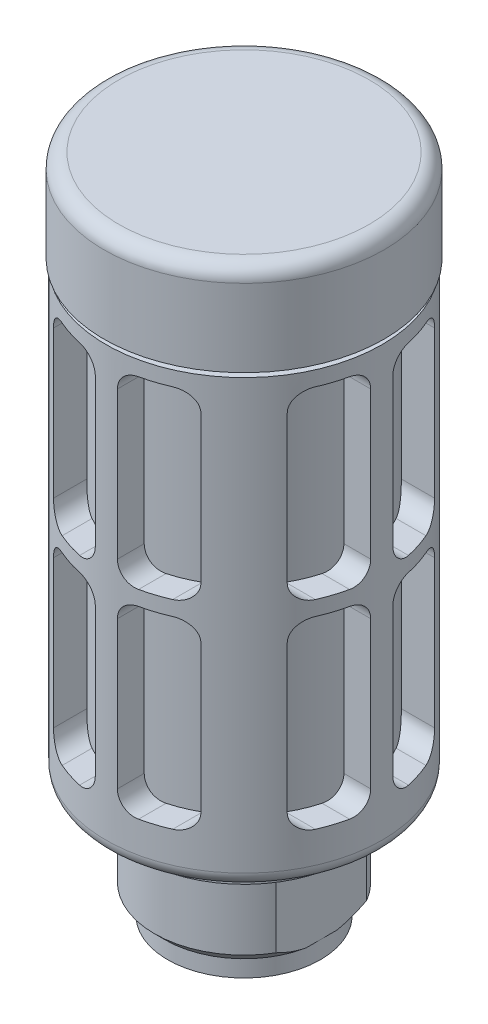
from build123d import *

# Parameters (mm, degrees)
SCHNITT_LINEAR_AUSTRAGEN1_DEPTH      = 20
SCHNITT_LINEAR_AUSTRAGEN1_DEPTH_BACK = 20
SCHNITT_LINEAR_AUSTRAGEN2_DEPTH      = 20
SCHNITT_LINEAR_AUSTRAGEN2_DEPTH_BACK = 20
SCHNITT_LINEAR_AUSTRAGEN3_DEPTH      = 20
SCHNITT_LINEAR_AUSTRAGEN3_DEPTH_BACK = 20
SCHNITT_LINEAR_AUSTRAGEN4_DEPTH      = 20
SCHNITT_LINEAR_AUSTRAGEN4_DEPTH_BACK = 20
SCHNITT_LINEAR_AUSTRAGEN5_DEPTH      = 20
SCHNITT_LINEAR_AUSTRAGEN5_DEPTH_BACK = 20
SCHNITT_LINEAR_AUSTRAGEN6_DEPTH      = 20
SCHNITT_LINEAR_AUSTRAGEN6_DEPTH_BACK = 20
SCHNITT_LINEAR_AUSTRAGEN7_DEPTH      = 20
SCHNITT_LINEAR_AUSTRAGEN7_DEPTH_BACK = 20
SCHNITT_LINEAR_AUSTRAGEN8_DEPTH      = 20
SCHNITT_LINEAR_AUSTRAGEN8_DEPTH_BACK = 20
SCHNITT_LINEAR_AUSTRAGEN9_DEPTH      = 15
SCHNITT_LINEAR_AUSTRAGEN9_DEPTH_BACK = 15


with BuildPart() as part:
    # Skizze1 → Rotation1 (revolve)
    with BuildSketch(Plane.XY):
        with BuildLine():
            Line((0, 34.9), (-6.05, 34.9))
            Line((-6.05, 34.9), (-6.05, 7.8))
            Line((-6.05, 7.8), (-3.2, 7.8))
            Line((-3.2, 7.8), (-3.2, 0.4))
            Line((-3.2, 0.4), (-3.6, 0))
            Line((-3.6, 0), (-4.15, 0))
            Line((-4.15, 0), (-4.15, 1))
            Line((-4.15, 1), (-4.283, 1))
            Line((-4.283, 1), (-4.864, 1.581))
            Line((-4.864, 1.581), (-4.864, 5.5))
            Line((-4.864, 5.5), (-5.7, 5.5))
            Line((-5.7, 5.5), (-5.7, 6.1))
            ThreePointArc((-5.7, 6.1), (-5.817157288, 6.382842712), (-6.1, 6.5))
            Line((-6.1, 6.5), (-6.7, 6.5))
            ThreePointArc((-6.7, 6.5), (-7.265685425, 6.734314575), (-7.5, 7.3))
            Line((-7.5, 7.3), (-7.5, 30.6))
            Line((-7.5, 30.6), (-7, 30.6))
            ThreePointArc((-7, 30.6), (-6.858578644, 30.658578644), (-6.8, 30.8))
            Line((-6.8, 30.8), (-6.8, 30.9))
            Line((-6.8, 30.9), (-7.6, 30.9))
            Line((-7.6, 30.9), (-7.6, 35.1))
            ThreePointArc((-7.6, 35.1), (-7.365685425, 35.665685425), (-6.8, 35.9))
            Line((-6.8, 35.9), (0, 35.9))
            Line((0, 35.9), (0, 34.9))
        make_face()
    revolve(axis=Axis((0, 35.9, 0), (0, -1, 0)))

    # Skizze2 → Schnitt-Linear austragen1 (cut, two sides: drawn at the far end of the back side and taken through both)
    with BuildSketch(Plane.XY.offset(-SCHNITT_LINEAR_AUSTRAGEN1_DEPTH_BACK)):
        with BuildLine():
            Line((1.6, 19.8), (3, 19.8))
            ThreePointArc((3, 19.8), (3.707106781, 20.092893219), (4, 20.8))
            Line((4, 20.8), (4, 28.8))
            ThreePointArc((4, 28.8), (3.707106781, 29.507106781), (3, 29.8))
            Line((3, 29.8), (1.6, 29.8))
            ThreePointArc((1.6, 29.8), (0.892893219, 29.507106781), (0.6, 28.8))
            Line((0.6, 28.8), (0.6, 20.8))
            ThreePointArc((0.6, 20.8), (0.892893219, 20.092893219), (1.6, 19.8))
        make_face()
    extrude(amount=SCHNITT_LINEAR_AUSTRAGEN1_DEPTH + SCHNITT_LINEAR_AUSTRAGEN1_DEPTH_BACK, mode=Mode.SUBTRACT)

    # Skizze3 → Schnitt-Linear austragen2 (cut, two sides: drawn at the far end of the back side and taken through both)
    with BuildSketch(Plane.XY.offset(-SCHNITT_LINEAR_AUSTRAGEN2_DEPTH_BACK)):
        with BuildLine():
            Line((1.6, 9), (3, 9))
            ThreePointArc((3, 9), (3.707106781, 9.292893219), (4, 10))
            Line((4, 10), (4, 18))
            ThreePointArc((4, 18), (3.707106781, 18.707106781), (3, 19))
            Line((3, 19), (1.6, 19))
            ThreePointArc((1.6, 19), (0.892893219, 18.707106781), (0.6, 18))
            Line((0.6, 18), (0.6, 10))
            ThreePointArc((0.6, 10), (0.892893219, 9.292893219), (1.6, 9))
        make_face()
    extrude(amount=SCHNITT_LINEAR_AUSTRAGEN2_DEPTH + SCHNITT_LINEAR_AUSTRAGEN2_DEPTH_BACK, mode=Mode.SUBTRACT)

    # Skizze4 → Schnitt-Linear austragen3 (cut, two sides: drawn at the far end of the back side and taken through both)
    with BuildSketch(Plane.XY.offset(-SCHNITT_LINEAR_AUSTRAGEN3_DEPTH_BACK)):
        with BuildLine():
            Line((-3, 19.8), (-1.6, 19.8))
            ThreePointArc((-1.6, 19.8), (-0.892893219, 20.092893219), (-0.6, 20.8))
            Line((-0.6, 20.8), (-0.6, 28.8))
            ThreePointArc((-0.6, 28.8), (-0.892893219, 29.507106781), (-1.6, 29.8))
            Line((-1.6, 29.8), (-3, 29.8))
            ThreePointArc((-3, 29.8), (-3.707106781, 29.507106781), (-4, 28.8))
            Line((-4, 28.8), (-4, 20.8))
            ThreePointArc((-4, 20.8), (-3.707106781, 20.092893219), (-3, 19.8))
        make_face()
    extrude(amount=SCHNITT_LINEAR_AUSTRAGEN3_DEPTH + SCHNITT_LINEAR_AUSTRAGEN3_DEPTH_BACK, mode=Mode.SUBTRACT)

    # Skizze5 → Schnitt-Linear austragen4 (cut, two sides: drawn at the far end of the back side and taken through both)
    with BuildSketch(Plane.XY.offset(-SCHNITT_LINEAR_AUSTRAGEN4_DEPTH_BACK)):
        with BuildLine():
            Line((-3, 9), (-1.6, 9))
            ThreePointArc((-1.6, 9), (-0.892893219, 9.292893219), (-0.6, 10))
            Line((-0.6, 10), (-0.6, 18))
            ThreePointArc((-0.6, 18), (-0.892893219, 18.707106781), (-1.6, 19))
            Line((-1.6, 19), (-3, 19))
            ThreePointArc((-3, 19), (-3.707106781, 18.707106781), (-4, 18))
            Line((-4, 18), (-4, 10))
            ThreePointArc((-4, 10), (-3.707106781, 9.292893219), (-3, 9))
        make_face()
    extrude(amount=SCHNITT_LINEAR_AUSTRAGEN4_DEPTH + SCHNITT_LINEAR_AUSTRAGEN4_DEPTH_BACK, mode=Mode.SUBTRACT)

    # Skizze6 → Schnitt-Linear austragen5 (cut, two sides: drawn at the far end of the back side and taken through both)
    with BuildSketch(Plane(origin=(0, 0, 0), x_dir=(0, 0, -1), z_dir=(1, 0, 0)).offset(-SCHNITT_LINEAR_AUSTRAGEN5_DEPTH_BACK)):
        with BuildLine():
            Line((-3, 19.8), (-1.6, 19.8))
            ThreePointArc((-1.6, 19.8), (-0.892893219, 20.092893219), (-0.6, 20.8))
            Line((-0.6, 20.8), (-0.6, 28.8))
            ThreePointArc((-0.6, 28.8), (-0.892893219, 29.507106781), (-1.6, 29.8))
            Line((-1.6, 29.8), (-3, 29.8))
            ThreePointArc((-3, 29.8), (-3.707106781, 29.507106781), (-4, 28.8))
            Line((-4, 28.8), (-4, 20.8))
            ThreePointArc((-4, 20.8), (-3.707106781, 20.092893219), (-3, 19.8))
        make_face()
    extrude(amount=SCHNITT_LINEAR_AUSTRAGEN5_DEPTH + SCHNITT_LINEAR_AUSTRAGEN5_DEPTH_BACK, mode=Mode.SUBTRACT)

    # Skizze7 → Schnitt-Linear austragen6 (cut, two sides: drawn at the far end of the back side and taken through both)
    with BuildSketch(Plane(origin=(0, 0, 0), x_dir=(0, 0, -1), z_dir=(1, 0, 0)).offset(-SCHNITT_LINEAR_AUSTRAGEN6_DEPTH_BACK)):
        with BuildLine():
            Line((-3, 9), (-1.6, 9))
            ThreePointArc((-1.6, 9), (-0.892893219, 9.292893219), (-0.6, 10))
            Line((-0.6, 10), (-0.6, 18))
            ThreePointArc((-0.6, 18), (-0.892893219, 18.707106781), (-1.6, 19))
            Line((-1.6, 19), (-3, 19))
            ThreePointArc((-3, 19), (-3.707106781, 18.707106781), (-4, 18))
            Line((-4, 18), (-4, 10))
            ThreePointArc((-4, 10), (-3.707106781, 9.292893219), (-3, 9))
        make_face()
    extrude(amount=SCHNITT_LINEAR_AUSTRAGEN6_DEPTH + SCHNITT_LINEAR_AUSTRAGEN6_DEPTH_BACK, mode=Mode.SUBTRACT)

    # Skizze8 → Schnitt-Linear austragen7 (cut, two sides: drawn at the far end of the back side and taken through both)
    with BuildSketch(Plane(origin=(0, 0, 0), x_dir=(0, 0, -1), z_dir=(1, 0, 0)).offset(-SCHNITT_LINEAR_AUSTRAGEN7_DEPTH_BACK)):
        with BuildLine():
            Line((1.6, 19.8), (3, 19.8))
            ThreePointArc((3, 19.8), (3.707106781, 20.092893219), (4, 20.8))
            Line((4, 20.8), (4, 28.8))
            ThreePointArc((4, 28.8), (3.707106781, 29.507106781), (3, 29.8))
            Line((3, 29.8), (1.6, 29.8))
            ThreePointArc((1.6, 29.8), (0.892893219, 29.507106781), (0.6, 28.8))
            Line((0.6, 28.8), (0.6, 20.8))
            ThreePointArc((0.6, 20.8), (0.892893219, 20.092893219), (1.6, 19.8))
        make_face()
    extrude(amount=SCHNITT_LINEAR_AUSTRAGEN7_DEPTH + SCHNITT_LINEAR_AUSTRAGEN7_DEPTH_BACK, mode=Mode.SUBTRACT)

    # Skizze9 → Schnitt-Linear austragen8 (cut, two sides: drawn at the far end of the back side and taken through both)
    with BuildSketch(Plane(origin=(0, 0, 0), x_dir=(0, 0, -1), z_dir=(1, 0, 0)).offset(-SCHNITT_LINEAR_AUSTRAGEN8_DEPTH_BACK)):
        with BuildLine():
            Line((1.6, 9), (3, 9))
            ThreePointArc((3, 9), (3.707106781, 9.292893219), (4, 10))
            Line((4, 10), (4, 18))
            ThreePointArc((4, 18), (3.707106781, 18.707106781), (3, 19))
            Line((3, 19), (1.6, 19))
            ThreePointArc((1.6, 19), (0.892893219, 18.707106781), (0.6, 18))
            Line((0.6, 18), (0.6, 10))
            ThreePointArc((0.6, 10), (0.892893219, 9.292893219), (1.6, 9))
        make_face()
    extrude(amount=SCHNITT_LINEAR_AUSTRAGEN8_DEPTH + SCHNITT_LINEAR_AUSTRAGEN8_DEPTH_BACK, mode=Mode.SUBTRACT)

    # Skizze10 → Schnitt-Linear austragen9 (cut, two sides: drawn at the far end of the back side and taken through both)
    with BuildSketch(Plane.XY.offset(-SCHNITT_LINEAR_AUSTRAGEN9_DEPTH_BACK)):
        Polygon((-6.2, -11.5), (6.2, -11.5), (6.2, 5.5), (4.2, 5.5), (4.2, -9.5), (-4.2, -9.5), (-4.2, 5.5), (-6.2, 5.5), align=None)
    extrude(amount=SCHNITT_LINEAR_AUSTRAGEN9_DEPTH + SCHNITT_LINEAR_AUSTRAGEN9_DEPTH_BACK, mode=Mode.SUBTRACT)

    # Skizze11 → Rotation2 (revolve)
    with BuildSketch(Plane.XY):
        with BuildLine():
            Line((0, 32.2), (-2.2, 32.2))
            ThreePointArc((-2.2, 32.2), (-2.907106781, 31.907106781), (-3.2, 31.2))
            Line((-3.2, 31.2), (-3.2, 7.8))
            Line((-3.2, 7.8), (-6.05, 7.8))
            Line((-6.05, 7.8), (-6.05, 34.9))
            Line((-6.05, 34.9), (0, 34.9))
            Line((0, 34.9), (0, 32.2))
        make_face()
    revolve(axis=Axis((0, 34.9, 0), (0, -1, 0)))


solid = part.part
